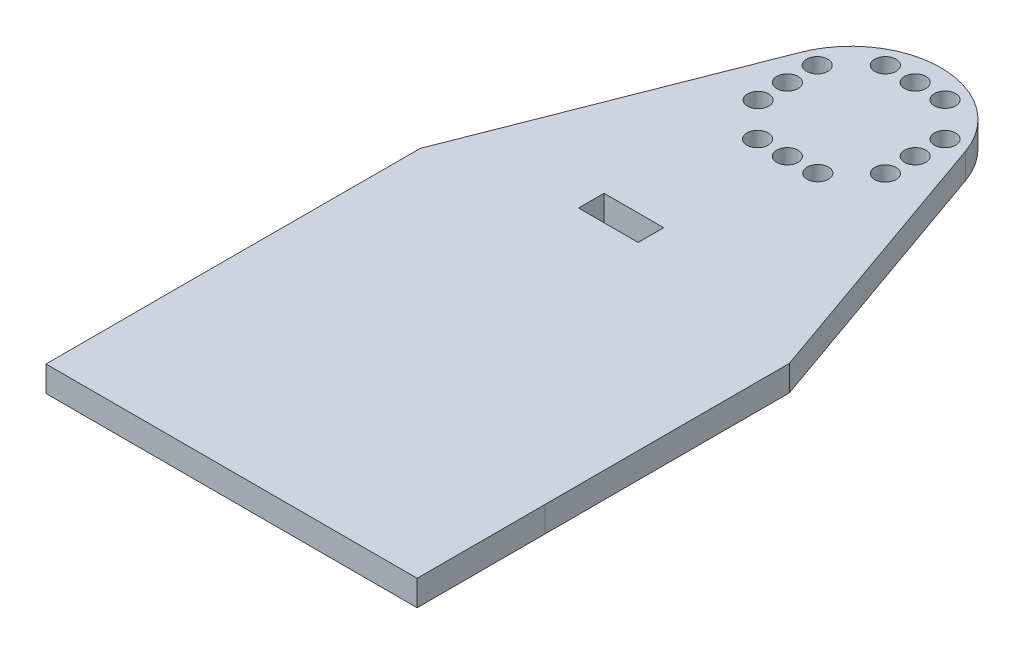
from build123d import *

# Parameters (mm, degrees)
SKETCH2_R           = 1.25
BOSS_EXTRUDE1_DEPTH = 3
SKETCH6_W           = 3
SKETCH6_H           = 29.12999922
BOSS_EXTRUDE3_DEPTH = 11.68
SKETCH9_R           = 1.75
CUT_EXTRUDE2_DEPTH  = 5
SKETCH10_W          = 43.550923211
SKETCH10_H          = 3
BOSS_EXTRUDE4_DEPTH = 15
SKETCH11_W          = 7
SKETCH11_H          = 3
CUT_EXTRUDE3_DEPTH  = 10


with BuildPart() as part:
    # Sketch2 → Boss-Extrude1 (new body)
    with BuildSketch(Plane(origin=(0, 0, 0), x_dir=(1, 0, 0), z_dir=(0, 1, 0))):
        with BuildLine():
            ThreePointArc((9.924191255, 3.512841719), (0, 10.527565199), (-9.924191255, 3.512841719))
            Line((-9.924191255, 3.512841719), (-22.339897891, -28.212185032))
            Line((-22.339897891, -28.212185032), (-22.388445596, -57.094438481))
            Line((-22.388445596, -57.094438481), (21.162477615, -57.094438481))
            Line((21.162477615, -57.094438481), (21.162544036, -28.414715022))
            Line((21.162544036, -28.414715022), (9.924191255, 3.512841719))
        make_face()
        with Locations((-3.499861001, -7.487216855)):
            Circle(SKETCH2_R, mode=Mode.SUBTRACT)
        with Locations((-7.42819985, -3.486548919)):
            Circle(SKETCH2_R, mode=Mode.SUBTRACT)
        with Locations((-7.499989222, 0.012714758)):
            Circle(SKETCH2_R, mode=Mode.SUBTRACT)
        with Locations((-7.500049059, 3.512714758)):
            Circle(SKETCH2_R, mode=Mode.SUBTRACT)
        with Locations((-3.500117445, 7.512783142)):
            Circle(SKETCH2_R, mode=Mode.SUBTRACT)
        with Locations((0.000138999, -7.487157018)):
            Circle(SKETCH2_R, mode=Mode.SUBTRACT)
        with Locations((3.499402676, -7.415367646)):
            Circle(SKETCH2_R, mode=Mode.SUBTRACT)
        with Locations((7.500070612, -3.487028797)):
            Circle(SKETCH2_R, mode=Mode.SUBTRACT)
        with Locations((7.500010775, 0.012971203)):
            Circle(SKETCH2_R, mode=Mode.SUBTRACT)
        with Locations((-0.000117446, 7.512842979)):
            Circle(SKETCH2_R, mode=Mode.SUBTRACT)
        with Locations((3.499882554, 7.512902816)):
            Circle(SKETCH2_R, mode=Mode.SUBTRACT)
        with Locations((7.500070612, 3.512971202)):
            Circle(SKETCH2_R, mode=Mode.SUBTRACT)
    extrude(amount=-BOSS_EXTRUDE1_DEPTH)

    # Sketch6 → Boss-Extrude3 (add)
    with BuildSketch(Plane.XZ.offset(3)):
        with Locations((-5, 42.529438871)):
            Rectangle(SKETCH6_W, SKETCH6_H)
    extrude(amount=-BOSS_EXTRUDE3_DEPTH)

    # Sketch9 → Cut-Extrude2 (cut)
    with BuildSketch(Plane(origin=(-3.5, 0, 0), x_dir=(0, 0, -1), z_dir=(1, 0, 0))):
        with Locations((-37.369439261, 3.88)):
            Circle(SKETCH9_R)
        with Locations((-47.719439261, 3.88)):
            Circle(SKETCH9_R)
    extrude(amount=-CUT_EXTRUDE2_DEPTH, mode=Mode.SUBTRACT)


with BuildPart() as body_2:
    # Mirror1: mirrored copy
    add(part.part.mirror(Plane(origin=(0, 8.68, 0), x_dir=(0, 0, 1), z_dir=(0, -1, 0))))

    # Sketch10 → Boss-Extrude4 (add)
    with BuildSketch(Plane.XY.offset(57.094438481)):
        with Locations((-0.612983991, 18.86)):
            Rectangle(SKETCH10_W, SKETCH10_H)
    extrude(amount=BOSS_EXTRUDE4_DEPTH)

    # Sketch11 → Cut-Extrude3 (cut)
    with BuildSketch(Plane.XZ.offset(-17.36)):
        with Locations((-3.5, 23.5)):
            Rectangle(SKETCH11_W, SKETCH11_H)
    extrude(amount=-CUT_EXTRUDE3_DEPTH, mode=Mode.SUBTRACT)


solid = body_2.part
